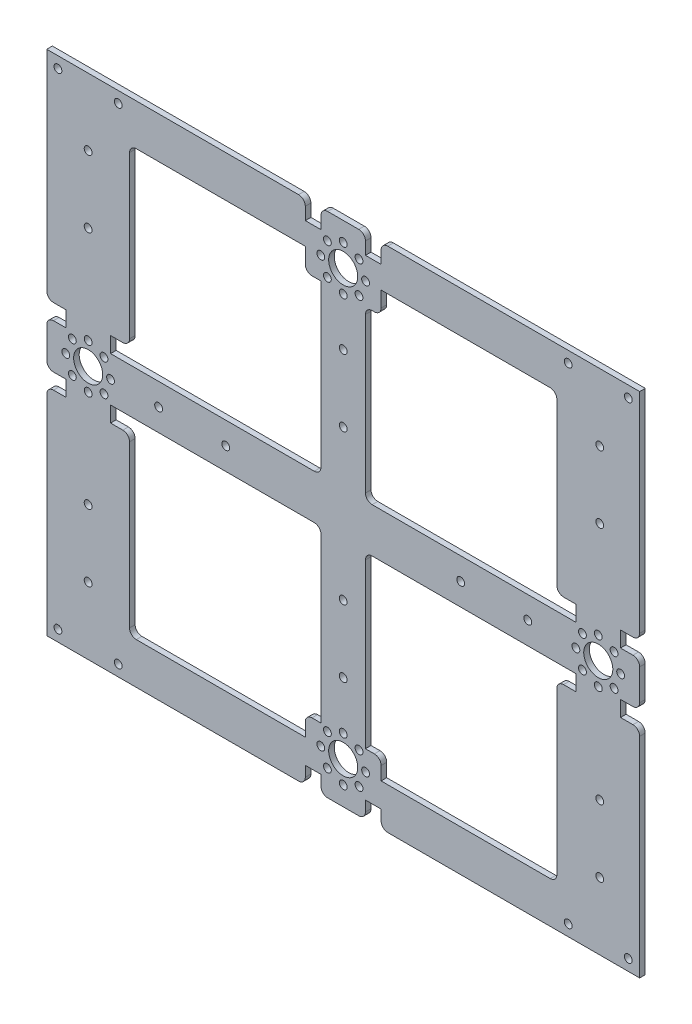
from build123d import *

# Parameters (mm, degrees)
ESQUISSE1_W              = 265
ESQUISSE1_H              = 227
ESQUISSE1_W_2            = 191
ESQUISSE1_H_2            = 190
BOSS_EXTRU_1_DEPTH       = 2.5
ESQUISSE2_R              = 6.5
ENL_V_MAT_EXTRU_1_DEPTH  = 2.5
ESQUISSE4_R              = 1.75
ENL_V_MAT_EXTRU_3_DEPTH  = 2.5
ESQUISSE7_R              = 1.75
ENL_V_MAT_EXTRU_4_DEPTH  = 2.5
ESQUISSE8_R              = 6.5
ENL_V_MAT_EXTRU_5_DEPTH  = 2.5
ESQUISSE9_R              = 1.75
ENL_V_MAT_EXTRU_6_DEPTH  = 2.5
ESQUISSE10_R             = 1.75
ENL_V_MAT_EXTRU_7_DEPTH  = 2.5
ESQUISSE12_R             = 1.75
ENL_V_MAT_EXTRU_8_DEPTH  = 2.5
ESQUISSE14_R             = 1.75
ENL_V_MAT_EXTRU_9_DEPTH  = 2.5
ESQUISSE15_R             = 1.75
ENL_V_MAT_EXTRU_10_DEPTH = 2.5
ESQUISSE16_W             = 43.02
ESQUISSE16_H             = 16.57
BOSS_EXTRU_3_DEPTH       = 2.5
CONG_1_R                 = 3
CONG_2_R                 = 3
ESQUISSE21_R             = 1.75
ENL_V_MAT_EXTRU_11_DEPTH = 2.5
ESQUISSE19_R             = 1.75
ENL_V_MAT_EXTRU_13_DEPTH = 2.5
ESQUISSE22_R             = 1.75
ENL_V_MAT_EXTRU_14_DEPTH = 2.5
BOSS_EXTRU_6_DEPTH       = 2.5
ESQUISSE29_R             = 6.5
ENL_V_MAT_EXTRU_16_DEPTH = 2.5
CONG_3_R                 = 3
CONG_4_R                 = 3
ESQUISSE30_R             = 6.5
ESQUISSE30_R_2           = 1.75
ESQUISSE30_W             = 9.747022527
ESQUISSE30_H             = 7
ESQUISSE30_W_2           = 9.747022528
ESQUISSE30_W_3           = 9.533500821
ESQUISSE30_W_4           = 7
ESQUISSE30_H_2           = 8.75
ENL_V_MAT_EXTRU_17_DEPTH = 22.5
ESQUISSE31_R             = 1.75
ENL_V_MAT_EXTRU_19_DEPTH = 22.5
ESQUISSE32_W             = 7
ESQUISSE32_H             = 9.212545878
ESQUISSE32_H_2           = 9.701573475
ENL_V_MAT_EXTRU_21_DEPTH = 22.5
ESQUISSE33_W             = 6.999266411
ESQUISSE33_H             = 16.57
ESQUISSE33_W_2           = 7.626957609
ENL_V_MAT_EXTRU_22_DEPTH = 22.5
ESQUISSE34_W             = 7.999831118
ESQUISSE34_H             = 20.224787638
ENL_V_MAT_EXTRU_24_DEPTH = 22.5
BOSS_EXTRU_7_DEPTH       = 2.5
CONG_5_R                 = 3
CONG_6_R                 = 3
CONG_7_R                 = 3
CONG_8_R                 = 3
CONG_9_R                 = 3
CONG_10_R                = 3
CONG_15_R                = 3
CONG_16_R                = 3
CONG_17_R                = 3
CONG_18_R                = 3
CONG_23_R                = 3
CONG_24_R                = 3
CONG_25_R                = 3
CONG_26_R                = 3
CONG_27_R                = 3
CONG_28_R                = 3
CONG_29_R                = 3
CONG_30_R                = 3
CONG_31_R                = 3
CONG_32_R                = 3
CONG_33_R                = 3
CONG_34_R                = 3
CONG_35_R                = 3
CONG_36_R                = 3
CONG_37_R                = 3
CONG_38_R                = 3
CONG_39_R                = 3
CONG_40_R                = 3
CONG_41_R                = 3
CONG_42_R                = 3
CONG_43_R                = 3
CONG_44_R                = 3
CONG_47_R                = 3
ESQUISSE36_R             = 1.75
ENL_V_MAT_EXTRU_26_DEPTH = 10
ESQUISSE36_7_R           = 1.75
ENL_V_MAT_EXTRU_27_DEPTH = 10


with BuildPart() as part:
    # Esquisse1 → Boss.-Extru.1 (new body)
    with BuildSketch(Plane.XY):
        with Locations((141.03421046, 123.375)):
            Rectangle(ESQUISSE1_W, ESQUISSE1_H)
        with Locations((141.03421046, 123.375)):
            Rectangle(ESQUISSE1_W_2, ESQUISSE1_H_2, mode=Mode.SUBTRACT)
    extrude(amount=BOSS_EXTRU_1_DEPTH)

    # Esquisse2 → Enlèv. mat.-Extru.1 (cut)
    with BuildSketch(Plane.XY.offset(2.5)):
        with Locations((27.04421046, 123.375)):
            Circle(ESQUISSE2_R)
    extrude(amount=-ENL_V_MAT_EXTRU_1_DEPTH, mode=Mode.SUBTRACT)

    # Esquisse4 → Enlèv. mat.-Extru.3 (cut)
    with BuildSketch(Plane.XY.offset(2.5)):
        with Locations((13.53421046, 231.875)):
            Circle(ESQUISSE4_R)
        with Locations((13.53421046, 14.875)):
            Circle(ESQUISSE4_R)
    extrude(amount=-ENL_V_MAT_EXTRU_3_DEPTH, mode=Mode.SUBTRACT)

    # Esquisse7 → Enlèv. mat.-Extru.4 (cut)
    with BuildSketch(Plane.XY.offset(2.5)):
        with Locations((13.61421046, 136.815)):
            Circle(ESQUISSE7_R)
        with Locations((40.47421046, 136.815)):
            Circle(ESQUISSE7_R)
        with Locations((13.61421046, 109.935)):
            Circle(ESQUISSE7_R)
        with Locations((40.47421046, 109.935)):
            Circle(ESQUISSE7_R)
    extrude(amount=-ENL_V_MAT_EXTRU_4_DEPTH, mode=Mode.SUBTRACT)

    # Esquisse8 → Enlèv. mat.-Extru.5 (cut)
    with BuildSketch(Plane.XY.offset(2.5)):
        with Locations((255.03421046, 123.375)):
            Circle(ESQUISSE8_R)
    extrude(amount=-ENL_V_MAT_EXTRU_5_DEPTH, mode=Mode.SUBTRACT)

    # Esquisse9 → Enlèv. mat.-Extru.6 (cut)
    with BuildSketch(Plane.XY.offset(2.5)):
        with Locations((241.59421046, 136.815)):
            Circle(ESQUISSE9_R)
        with Locations((241.59421046, 109.935)):
            Circle(ESQUISSE9_R)
        with Locations((268.47421046, 136.815)):
            Circle(ESQUISSE9_R)
        with Locations((268.47421046, 109.935)):
            Circle(ESQUISSE9_R)
    extrude(amount=-ENL_V_MAT_EXTRU_6_DEPTH, mode=Mode.SUBTRACT)

    # Esquisse10 → Enlèv. mat.-Extru.7 (cut)
    with BuildSketch(Plane.XY.offset(2.5)):
        with Locations((40.47421046, 231.875)):
            Circle(ESQUISSE10_R)
    extrude(amount=-ENL_V_MAT_EXTRU_7_DEPTH, mode=Mode.SUBTRACT)

    # Esquisse12 → Enlèv. mat.-Extru.8 (cut)
    with BuildSketch(Plane.XY.offset(2.5)):
        with Locations((40.47421046, 14.875)):
            Circle(ESQUISSE12_R)
    extrude(amount=-ENL_V_MAT_EXTRU_8_DEPTH, mode=Mode.SUBTRACT)

    # Esquisse14 → Enlèv. mat.-Extru.9 (cut)
    with BuildSketch(Plane.XY.offset(2.5)):
        with Locations((241.59421046, 231.875)):
            Circle(ESQUISSE14_R)
        with Locations((268.47421046, 231.875)):
            Circle(ESQUISSE14_R)
        with Locations((268.47421046, 14.875)):
            Circle(ESQUISSE14_R)
        with Locations((241.59421046, 14.875)):
            Circle(ESQUISSE14_R)
    extrude(amount=-ENL_V_MAT_EXTRU_9_DEPTH, mode=Mode.SUBTRACT)

    # Esquisse15 → Enlèv. mat.-Extru.10 (cut)
    with BuildSketch(Plane.XY.offset(2.5)):
        with Locations((127.59421046, 231.815)):
            Circle(ESQUISSE15_R)
    extrude(amount=-ENL_V_MAT_EXTRU_10_DEPTH, mode=Mode.SUBTRACT)

    # Esquisse16 → Boss.-Extru.3 (add)
    with BuildSketch(Plane.XY.offset(2.5)):
        with Locations((141.03421046, 210.09)):
            Rectangle(ESQUISSE16_W, ESQUISSE16_H)
    extrude(amount=-BOSS_EXTRU_3_DEPTH)

    # Congé1
    cong_1_edges = [part.edges().sort_by_distance(p)[0] for p in [
        (119.52421046, 201.805, 1.25),
    ]]
    fillet(cong_1_edges, radius=CONG_1_R)

    # Congé2
    cong_2_edges = [part.edges().sort_by_distance(p)[0] for p in [
        (162.54421046, 201.805, 1.25),
    ]]
    fillet(cong_2_edges, radius=CONG_2_R)

    # Esquisse21 → Enlèv. mat.-Extru.11 (cut)
    with BuildSketch(Plane.XY.offset(2.5)):
        with Locations((154.48421046, 204.935)):
            Circle(ESQUISSE21_R)
    extrude(amount=-ENL_V_MAT_EXTRU_11_DEPTH, mode=Mode.SUBTRACT)

    # Esquisse19 → Enlèv. mat.-Extru.13 (cut)
    with BuildSketch(Plane.XY.offset(2.5)):
        with Locations((154.47421046, 231.815)):
            Circle(ESQUISSE19_R)
    extrude(amount=-ENL_V_MAT_EXTRU_13_DEPTH, mode=Mode.SUBTRACT)

    # Esquisse22 → Enlèv. mat.-Extru.14 (cut)
    with BuildSketch(Plane.XY.offset(2.5)):
        with Locations((127.59421046, 204.935)):
            Circle(ESQUISSE22_R)
    extrude(amount=-ENL_V_MAT_EXTRU_14_DEPTH, mode=Mode.SUBTRACT)

    # Esquisse23 → Boss.-Extru.6 (add)
    with BuildSketch(Plane.XY.offset(2.5)):
        with BuildLine():
            Line((119.52421046, 44.945), (119.52421046, 28.375))
            Line((119.52421046, 28.375), (134.53421046, 28.375))
            ThreePointArc((134.53421046, 28.375), (141.03421046, 34.875), (147.53421046, 28.375))
            Line((147.53421046, 28.375), (162.54421046, 28.375))
            Line((162.54421046, 28.375), (162.54421046, 44.945))
            Line((162.54421046, 44.945), (119.52421046, 44.945))
        make_face()
    extrude(amount=-BOSS_EXTRU_6_DEPTH)

    # Esquisse29 → Enlèv. mat.-Extru.16 (cut)
    with BuildSketch(Plane.XY.offset(2.5)):
        with Locations((141.03421046, 28.375)):
            Circle(ESQUISSE29_R)
    extrude(amount=-ENL_V_MAT_EXTRU_16_DEPTH, mode=Mode.SUBTRACT)

    # Congé3
    cong_3_edges = [part.edges().sort_by_distance(p)[0] for p in [
        (119.52421046, 44.945, 1.25),
    ]]
    fillet(cong_3_edges, radius=CONG_3_R)

    # Congé4
    cong_4_edges = [part.edges().sort_by_distance(p)[0] for p in [
        (162.54421046, 44.945, 1.25),
    ]]
    fillet(cong_4_edges, radius=CONG_4_R)

    # Esquisse30 → Enlèv. mat.-Extru.17 (cut)
    with BuildSketch(Plane.XY.offset(2.5)):
        with Locations((141.03421046, 218.375)):
            Circle(ESQUISSE30_R)
        with Locations((27.04421046, 133.375)):
            Circle(ESQUISSE30_R_2)
        with Locations((262.105278272, 130.446067812)):
            Circle(ESQUISSE30_R_2)
        with Locations((34.115278272, 130.446067812)):
            Circle(ESQUISSE30_R_2)
        with Locations((37.04421046, 123.375)):
            Circle(ESQUISSE30_R_2)
        with Locations((34.115278272, 116.303932188)):
            Circle(ESQUISSE30_R_2)
        with Locations((27.04421046, 113.375)):
            Circle(ESQUISSE30_R_2)
        with Locations((19.973142648, 116.303932188)):
            Circle(ESQUISSE30_R_2)
        with Locations((17.04421046, 123.375)):
            Circle(ESQUISSE30_R_2)
        with Locations((19.973142648, 130.446067812)):
            Circle(ESQUISSE30_R_2)
        with Locations((141.03421046, 228.375)):
            Circle(ESQUISSE30_R_2)
        with Locations((148.105278272, 225.446067812)):
            Circle(ESQUISSE30_R_2)
        with Locations((151.03421046, 218.375)):
            Circle(ESQUISSE30_R_2)
        with Locations((148.105278272, 211.303932188)):
            Circle(ESQUISSE30_R_2)
        with Locations((141.03421046, 208.375)):
            Circle(ESQUISSE30_R_2)
        with Locations((133.963142648, 211.303932188)):
            Circle(ESQUISSE30_R_2)
        with Locations((131.03421046, 218.375)):
            Circle(ESQUISSE30_R_2)
        with Locations((133.963142648, 225.446067812)):
            Circle(ESQUISSE30_R_2)
        with Locations((255.03421046, 133.375)):
            Circle(ESQUISSE30_R_2)
        with Locations((265.03421046, 123.375)):
            Circle(ESQUISSE30_R_2)
        with Locations((262.105278272, 116.303932188)):
            Circle(ESQUISSE30_R_2)
        with Locations((255.03421046, 113.375)):
            Circle(ESQUISSE30_R_2)
        with Locations((247.963142648, 116.303932188)):
            Circle(ESQUISSE30_R_2)
        with Locations((245.03421046, 123.375)):
            Circle(ESQUISSE30_R_2)
        with Locations((247.963142648, 130.446067812)):
            Circle(ESQUISSE30_R_2)
        with Locations((141.03421046, 38.375)):
            Circle(ESQUISSE30_R_2)
        with Locations((148.105278272, 35.446067812)):
            Circle(ESQUISSE30_R_2)
        with Locations((151.03421046, 28.375)):
            Circle(ESQUISSE30_R_2)
        with Locations((148.105278272, 21.303932188)):
            Circle(ESQUISSE30_R_2)
        with Locations((141.03421046, 18.375)):
            Circle(ESQUISSE30_R_2)
        with Locations((133.963142648, 21.303932188)):
            Circle(ESQUISSE30_R_2)
        with Locations((131.03421046, 28.375)):
            Circle(ESQUISSE30_R_2)
        with Locations((133.963142648, 35.446067812)):
            Circle(ESQUISSE30_R_2)
        with Locations((12.170699197, 136.815)):
            Rectangle(ESQUISSE30_W, ESQUISSE30_H)
        with Locations((41.917721724, 109.935)):
            Rectangle(ESQUISSE30_W_2, ESQUISSE30_H)
        with Locations((12.170699197, 109.935)):
            Rectangle(ESQUISSE30_W, ESQUISSE30_H)
        with Locations((41.917721724, 136.815)):
            Rectangle(ESQUISSE30_W_2, ESQUISSE30_H)
        with Locations((240.32746005, 109.935)):
            Rectangle(ESQUISSE30_W_3, ESQUISSE30_H)
        with Locations((127.59421046, 204.059162884)):
            Rectangle(ESQUISSE30_W_4, ESQUISSE30_H_2)
        with Locations((240.32746005, 136.815)):
            Rectangle(ESQUISSE30_W_3, ESQUISSE30_H)
        with Locations((269.74096087, 109.935)):
            Rectangle(ESQUISSE30_W_3, ESQUISSE30_H)
        with Locations((269.74096087, 136.815)):
            Rectangle(ESQUISSE30_W_3, ESQUISSE30_H)
        with Locations((127.59421046, 232.690837116)):
            Rectangle(ESQUISSE30_W_4, ESQUISSE30_H_2)
        with Locations((154.47421046, 232.690837116)):
            Rectangle(ESQUISSE30_W_4, ESQUISSE30_H_2)
        with Locations((154.47421046, 204.059162884)):
            Rectangle(ESQUISSE30_W_4, ESQUISSE30_H_2)
    extrude(amount=-ENL_V_MAT_EXTRU_17_DEPTH, mode=Mode.SUBTRACT)

    # Esquisse31 → Enlèv. mat.-Extru.19 (cut)
    with BuildSketch(Plane.XY.offset(2.5)):
        with Locations((127.59421046, 40.845)):
            Circle(ESQUISSE31_R)
        with Locations((154.47421046, 40.845)):
            Circle(ESQUISSE31_R)
        with Locations((127.59421046, 13.975)):
            Circle(ESQUISSE31_R)
        with Locations((154.47421046, 13.975)):
            Circle(ESQUISSE31_R)
    extrude(amount=-ENL_V_MAT_EXTRU_19_DEPTH, mode=Mode.SUBTRACT)

    # Esquisse32 → Enlèv. mat.-Extru.21 (cut)
    with BuildSketch(Plane.XY.offset(2.5)):
        with Locations((127.59421046, 41.951272939)):
            Rectangle(ESQUISSE32_W, ESQUISSE32_H)
        with Locations((154.47421046, 41.951272939)):
            Rectangle(ESQUISSE32_W, ESQUISSE32_H)
        with Locations((154.47421046, 12.624213263)):
            Rectangle(ESQUISSE32_W, ESQUISSE32_H_2)
        with Locations((127.59421046, 12.624213263)):
            Rectangle(ESQUISSE32_W, ESQUISSE32_H_2)
    extrude(amount=-ENL_V_MAT_EXTRU_21_DEPTH, mode=Mode.SUBTRACT)

    # Esquisse33 → Enlèv. mat.-Extru.22 (cut)
    with BuildSketch(Plane.XY.offset(2.5)):
        with Locations((120.594577255, 36.66)):
            Rectangle(ESQUISSE33_W, ESQUISSE33_H)
        with Locations((161.787689265, 36.66)):
            Rectangle(ESQUISSE33_W_2, ESQUISSE33_H)
    extrude(amount=-ENL_V_MAT_EXTRU_22_DEPTH, mode=Mode.SUBTRACT)

    # Esquisse34 → Enlèv. mat.-Extru.24 (cut)
    with BuildSketch(Plane.XY.offset(2.5)):
        with Locations((120.094294901, 208.262606181)):
            Rectangle(ESQUISSE34_W, ESQUISSE34_H)
        with Locations((161.974126019, 208.262606181)):
            Rectangle(ESQUISSE34_W, ESQUISSE34_H)
    extrude(amount=-ENL_V_MAT_EXTRU_24_DEPTH, mode=Mode.SUBTRACT)

    # Esquisse33<3> → Boss.-Extru.7 (add)
    with BuildSketch(Plane.XY.offset(2.5)):
        Polygon((150.97421046, 201.805), (131.09421046, 201.805), (131.09421046, 133.315), (45.53421046, 133.315), (45.53421046, 113.435), (131.09421046, 113.435), (131.09421046, 44.945), (150.97421046, 44.945), (150.97421046, 113.435), (236.53421046, 113.435), (236.53421046, 133.315), (150.97421046, 133.315), align=None)
    extrude(amount=-BOSS_EXTRU_7_DEPTH)

    # Congé5
    cong_5_edges = [part.edges().sort_by_distance(p)[0] for p in [
        (45.53421046, 106.435, 1.25),
    ]]
    fillet(cong_5_edges, radius=CONG_5_R)

    # Congé6
    cong_6_edges = [part.edges().sort_by_distance(p)[0] for p in [
        (8.53421046, 106.435, 1.25),
    ]]
    fillet(cong_6_edges, radius=CONG_6_R)

    # Congé7
    cong_7_edges = [part.edges().sort_by_distance(p)[0] for p in [
        (131.09421046, 113.435, 1.25),
    ]]
    fillet(cong_7_edges, radius=CONG_7_R)

    # Congé8
    cong_8_edges = [part.edges().sort_by_distance(p)[0] for p in [
        (131.09421046, 133.315, 1.25),
    ]]
    fillet(cong_8_edges, radius=CONG_8_R)

    # Congé9
    cong_9_edges = [part.edges().sort_by_distance(p)[0] for p in [
        (150.97421046, 113.435, 1.25),
    ]]
    fillet(cong_9_edges, radius=CONG_9_R)

    # Congé10
    cong_10_edges = [part.edges().sort_by_distance(p)[0] for p in [
        (150.97421046, 133.315, 1.25),
    ]]
    fillet(cong_10_edges, radius=CONG_10_R)

    # Congé15
    cong_15_edges = [part.edges().sort_by_distance(p)[0] for p in [
        (157.97421046, 37.345, 1.25),
    ]]
    fillet(cong_15_edges, radius=CONG_15_R)

    # Congé16
    cong_16_edges = [part.edges().sort_by_distance(p)[0] for p in [
        (124.09421046, 37.345, 1.25),
    ]]
    fillet(cong_16_edges, radius=CONG_16_R)

    # Congé17
    cong_17_edges = [part.edges().sort_by_distance(p)[0] for p in [
        (8.53421046, 133.315, 1.25),
    ]]
    fillet(cong_17_edges, radius=CONG_17_R)

    # Congé18
    cong_18_edges = [part.edges().sort_by_distance(p)[0] for p in [
        (8.53421046, 113.435, 1.25),
    ]]
    fillet(cong_18_edges, radius=CONG_18_R)

    # Congé23
    cong_23_edges = [part.edges().sort_by_distance(p)[0] for p in [
        (45.53421046, 140.315, 1.25),
    ]]
    fillet(cong_23_edges, radius=CONG_23_R)

    # Congé24
    cong_24_edges = [part.edges().sort_by_distance(p)[0] for p in [
        (8.53421046, 140.315, 1.25),
    ]]
    fillet(cong_24_edges, radius=CONG_24_R)

    # Congé25
    cong_25_edges = [part.edges().sort_by_distance(p)[0] for p in [
        (236.53421046, 140.315, 1.25),
    ]]
    fillet(cong_25_edges, radius=CONG_25_R)

    # Congé26
    cong_26_edges = [part.edges().sort_by_distance(p)[0] for p in [
        (236.53421046, 106.435, 1.25),
    ]]
    fillet(cong_26_edges, radius=CONG_26_R)

    # Congé27
    cong_27_edges = [part.edges().sort_by_distance(p)[0] for p in [
        (273.53421046, 140.315, 1.25),
    ]]
    fillet(cong_27_edges, radius=CONG_27_R)

    # Congé28
    cong_28_edges = [part.edges().sort_by_distance(p)[0] for p in [
        (273.53421046, 106.435, 1.25),
    ]]
    fillet(cong_28_edges, radius=CONG_28_R)

    # Congé29
    cong_29_edges = [part.edges().sort_by_distance(p)[0] for p in [
        (273.53421046, 113.435, 1.25),
    ]]
    fillet(cong_29_edges, radius=CONG_29_R)

    # Congé30
    cong_30_edges = [part.edges().sort_by_distance(p)[0] for p in [
        (273.53421046, 133.315, 1.25),
    ]]
    fillet(cong_30_edges, radius=CONG_30_R)

    # Congé31
    cong_31_edges = [part.edges().sort_by_distance(p)[0] for p in [
        (150.97421046, 9.875, 1.25),
    ]]
    fillet(cong_31_edges, radius=CONG_31_R)

    # Congé32
    cong_32_edges = [part.edges().sort_by_distance(p)[0] for p in [
        (131.09421046, 9.875, 1.25),
    ]]
    fillet(cong_32_edges, radius=CONG_32_R)

    # Congé33
    cong_33_edges = [part.edges().sort_by_distance(p)[0] for p in [
        (131.09421046, 236.875, 1.25),
    ]]
    fillet(cong_33_edges, radius=CONG_33_R)

    # Congé34
    cong_34_edges = [part.edges().sort_by_distance(p)[0] for p in [
        (150.97421046, 236.875, 1.25),
    ]]
    fillet(cong_34_edges, radius=CONG_34_R)

    # Congé35
    cong_35_edges = [part.edges().sort_by_distance(p)[0] for p in [
        (157.97421046, 236.875, 1.25),
    ]]
    fillet(cong_35_edges, radius=CONG_35_R)

    # Congé36
    cong_36_edges = [part.edges().sort_by_distance(p)[0] for p in [
        (124.09421046, 236.875, 1.25),
    ]]
    fillet(cong_36_edges, radius=CONG_36_R)

    # Congé37
    cong_37_edges = [part.edges().sort_by_distance(p)[0] for p in [
        (124.09421046, 208.434162884, 1.25),
    ]]
    fillet(cong_37_edges, radius=CONG_37_R)

    # Congé38
    cong_38_edges = [part.edges().sort_by_distance(p)[0] for p in [
        (157.97421046, 208.434162884, 1.25),
    ]]
    fillet(cong_38_edges, radius=CONG_38_R)

    # Congé39
    cong_39_edges = [part.edges().sort_by_distance(p)[0] for p in [
        (45.53421046, 218.375, 1.25),
    ]]
    fillet(cong_39_edges, radius=CONG_39_R)

    # Congé40
    cong_40_edges = [part.edges().sort_by_distance(p)[0] for p in [
        (236.53421046, 218.375, 1.25),
    ]]
    fillet(cong_40_edges, radius=CONG_40_R)

    # Congé41
    cong_41_edges = [part.edges().sort_by_distance(p)[0] for p in [
        (45.53421046, 28.375, 1.25),
    ]]
    fillet(cong_41_edges, radius=CONG_41_R)

    # Congé42
    cong_42_edges = [part.edges().sort_by_distance(p)[0] for p in [
        (236.53421046, 28.375, 1.25),
    ]]
    fillet(cong_42_edges, radius=CONG_42_R)

    # Congé43
    cong_43_edges = [part.edges().sort_by_distance(p)[0] for p in [
        (124.09421046, 9.875, 1.25),
    ]]
    fillet(cong_43_edges, radius=CONG_43_R)

    # Congé44
    cong_44_edges = [part.edges().sort_by_distance(p)[0] for p in [
        (157.97421046, 9.875, 1.25),
    ]]
    fillet(cong_44_edges, radius=CONG_44_R)

    # Congé47
    cong_47_edges = [part.edges().sort_by_distance(p)[0] for p in [
        (150.97421046, 208.434162884, 1.25),
    ]]
    fillet(cong_47_edges, radius=CONG_47_R)

    # Esquisse36 → Enlèv. mat.-Extru.26 (cut)
    with BuildSketch(Plane.XY.offset(2.5)):
        with Locations((141.03421046, 59.875)):
            Circle(ESQUISSE36_R)
        with Locations((141.03421046, 89.875)):
            Circle(ESQUISSE36_R)
        with Locations((58.53421046, 123.375)):
            Circle(ESQUISSE36_R)
        with Locations((88.53421046, 123.375)):
            Circle(ESQUISSE36_R)
    extrude(amount=-ENL_V_MAT_EXTRU_26_DEPTH, mode=Mode.SUBTRACT)

    # Esquisse36<7> → Enlèv. mat.-Extru.27 (cut)
    with BuildSketch(Plane.XY.offset(2.5)):
        with Locations((223.53421046, 123.375)):
            Circle(ESQUISSE36_7_R)
        with Locations((141.03421046, 186.875)):
            Circle(ESQUISSE36_7_R)
        with Locations((141.03421046, 156.875)):
            Circle(ESQUISSE36_7_R)
        with Locations((193.53421046, 123.375)):
            Circle(ESQUISSE36_7_R)
        with Locations((27.03421046, 206.875)):
            Circle(ESQUISSE36_7_R)
        with Locations((27.03421046, 176.875)):
            Circle(ESQUISSE36_7_R)
        with Locations((27.03421046, 39.875)):
            Circle(ESQUISSE36_7_R)
        with Locations((27.03421046, 69.875)):
            Circle(ESQUISSE36_7_R)
        with Locations((255.707844229, 69.875)):
            Circle(ESQUISSE36_7_R)
        with Locations((255.707844229, 39.875)):
            Circle(ESQUISSE36_7_R)
        with Locations((255.707844229, 206.875)):
            Circle(ESQUISSE36_7_R)
        with Locations((255.707844229, 176.875)):
            Circle(ESQUISSE36_7_R)
    extrude(amount=-ENL_V_MAT_EXTRU_27_DEPTH, mode=Mode.SUBTRACT)


solid = part.part
